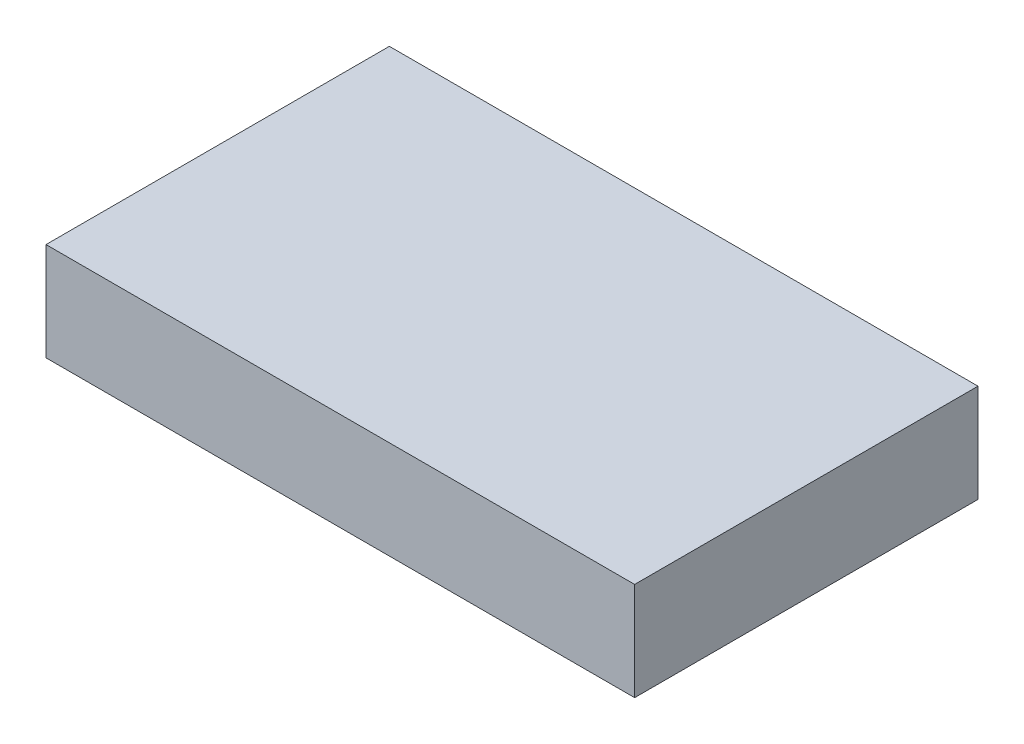
from build123d import *

# Parameters (mm, degrees)
SKETCH1_W           = 120
SKETCH1_H           = 70
BOSS_EXTRUDE1_DEPTH = 20


with BuildPart() as part:
    # Sketch1 → Boss-Extrude1 (new body)
    with BuildSketch(Plane(origin=(0, 0, 0), x_dir=(1, 0, 0), z_dir=(0, 1, 0))):
        Rectangle(SKETCH1_W, SKETCH1_H)
    extrude(amount=BOSS_EXTRUDE1_DEPTH)


solid = part.part
